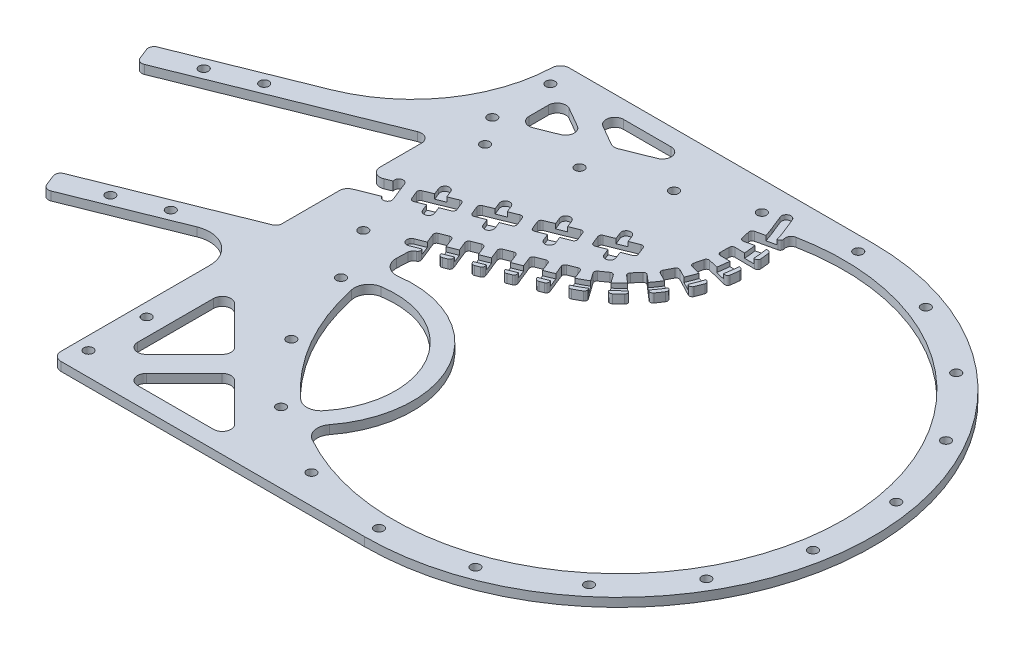
from build123d import *

# Parameters (mm, degrees)
SKETCH_1_R                       = 77.5
EXTRUDE_1_DEPTH                  = 3
SKETCH_3_R                       = 1.6
CUT_EXTRUDE_1_DEPTH              = 3
PATTERN_CIRCULAR_1_OUTLINE_R     = 1.6
PATTERN_CIRCULAR_1_DEPTH         = 3
SKETCH_4_R                       = 1.6
CUT_EXTRUDE_2_DEPTH              = 3
PATTERN_LINEAR_1_COUNT           = 3
PATTERN_LINEAR_1_PITCH           = 25
EXTRUDE_4_DEPTH                  = 3
CUT_EXTRUDE_3_DEPTH              = 1.6
CUT_EXTRUDE_4_DEPTH              = 11.6
FILLET_1_R                       = 1
PATTERN_CIRCULAR_2_COUNT         = 7
PATTERN_CIRCULAR_2_ANGLE         = 81
FILLET_1_OF_PATTERN_CIRCULAR_2_R = 1
FILLET_2_R                       = 2
PATTERN_LINEAR_2_COUNT           = 5
PATTERN_LINEAR_2_PITCH           = 8.5
FILLET_1_OF_PATTERN_LINEAR_2_R   = 1
FILLET_3_R                       = 2
FILLET_4_R                       = 1
CUT_EXTRUDE_5_DEPTH              = 11.6
FILLET_5_R                       = 1
CUT_EXTRUDE_6_DEPTH              = 1.6
PATTERN_LINEAR_3_COUNT           = 4
PATTERN_LINEAR_3_PITCH           = 16
FILLET_5_OF_PATTERN_LINEAR_3_R   = 1
CUT_EXTRUDE_7_DEPTH              = 10
SKETCH_16_R                      = 1.5
CUT_EXTRUDE_8_DEPTH              = 10
SKETCH_17_R                      = 1.6
EXTRUDE_6_DEPTH                  = 3
FILLET_6_R                       = 2
FILLET_7_R                       = 3
FILLET_8_R                       = 3
FILLET_9_R                       = 10
FILLET_10_R                      = 50
FILLET_11_R                      = 2
SKETCH_19_R                      = 1.6
CUT_EXTRUDE_10_DEPTH             = 10
SKETCH_22_R                      = 1.6
CUT_EXTRUDE_11_DEPTH             = 11.6
CUT_EXTRUDE_12_DEPTH             = 11.6
FILLET_12_R                      = 3
FILLET_13_R                      = 3
EXTRUDE_START                    = -3
EXTRUDE_7_DEPTH                  = 3
FILLET_14_R                      = 5


# Read off the part's stored shape, not the designer's step: 阵列(圆周)1
with BuildPart() as part:
    # 草图1 → 凸台-拉伸1 (new body)
    with BuildSketch(Plane(origin=(0, 0, 0), x_dir=(1, 0, 0), z_dir=(0, 1, 0))):
        with BuildLine():
            Line((-107.5, 87.5), (0, 87.5))
            ThreePointArc((0, 87.5), (87.5, 0), (0, -87.5))
            Line((0, -87.5), (-107.5, -87.5))
            Line((-107.5, -87.5), (-107.5, 87.5))
        make_face()
        with Locations(Location((0, 0, 0), (0, 0, 270))):
            Circle(SKETCH_1_R, mode=Mode.SUBTRACT)
    extrude(amount=EXTRUDE_1_DEPTH)

    # 草图3 → 切除-拉伸1 (cut)
    with BuildSketch(Plane(origin=(0, 3, 0), x_dir=(1, 0, 0), z_dir=(0, 1, 0))):
        with Locations(Location((0, 82.5, 0), (0, 0, 270))):
            Circle(SKETCH_3_R)
    extrude(amount=-CUT_EXTRUDE_1_DEPTH, mode=Mode.SUBTRACT)

    # 阵列(圆周)1 outline → 阵列(圆周)1 (cut)
    with BuildSketch(Plane(origin=(0, 0, 0), x_dir=(1, 0, 0), z_dir=(0, 1, 0))):
        with Locations((28.216661824, 77.524641215)):
            Circle(PATTERN_CIRCULAR_1_OUTLINE_R)
        with Locations((53.029977799, 63.198666557)):
            Circle(PATTERN_CIRCULAR_1_OUTLINE_R)
        with Locations((71.447095812, 41.25)):
            Circle(PATTERN_CIRCULAR_1_OUTLINE_R)
        with Locations((81.246639624, 14.325974658)):
            Circle(PATTERN_CIRCULAR_1_OUTLINE_R)
        with Locations((81.246639624, -14.325974658)):
            Circle(PATTERN_CIRCULAR_1_OUTLINE_R)
        with Locations((71.447095812, -41.25)):
            Circle(PATTERN_CIRCULAR_1_OUTLINE_R)
        with Locations((53.029977799, -63.198666557)):
            Circle(PATTERN_CIRCULAR_1_OUTLINE_R)
        with Locations((28.216661824, -77.524641215)):
            Circle(PATTERN_CIRCULAR_1_OUTLINE_R)
        with Locations((0, -82.5)):
            Circle(PATTERN_CIRCULAR_1_OUTLINE_R)
        with Locations((-28.216661824, -77.524641215)):
            Circle(PATTERN_CIRCULAR_1_OUTLINE_R)
        with Locations((-53.029977799, -63.198666557)):
            Circle(PATTERN_CIRCULAR_1_OUTLINE_R)
        with Locations((-71.447095812, -41.25)):
            Circle(PATTERN_CIRCULAR_1_OUTLINE_R)
        with Locations((-81.246639624, -14.325974658)):
            Circle(PATTERN_CIRCULAR_1_OUTLINE_R)
        with Locations((-28.216661824, 77.524641215)):
            Circle(PATTERN_CIRCULAR_1_OUTLINE_R)
    extrude(amount=PATTERN_CIRCULAR_1_DEPTH, mode=Mode.SUBTRACT)

    # 草图4 → 切除-拉伸2 (cut)
    with BuildSketch(Plane(origin=(0, 3, 0), x_dir=(1, 0, 0), z_dir=(0, 1, 0))):
        with Locations(Location((-49.817794007, 68.881691329, 0), (0, 0, 270))):
            Circle(SKETCH_4_R)
    cut_extrude_2 = extrude(amount=-CUT_EXTRUDE_2_DEPTH, mode=Mode.SUBTRACT)

    # 阵列(线性)1: 切除-拉伸2 ×3
    with Locations(*[Vector(-0.9276972686292775, 0, 0.37333333333333385) * (i * PATTERN_LINEAR_1_PITCH) for i in range(1, PATTERN_LINEAR_1_COUNT)]):
        add(cut_extrude_2, mode=Mode.SUBTRACT)

    # 草图6 → 凸台-拉伸4 (add)
    with BuildSketch(Plane(origin=(0, 3, 0), x_dir=(1, 0, 0), z_dir=(0, 1, 0))):
        with BuildLine():
            Line((-97.5, 44.303245671), (-17.609017449, 76.453784243))
            ThreePointArc((-17.609017449, 76.453784243), (-17.941394869, 43.544687501), (-41.446666667, 20.509468359))
            Line((-41.446666667, 20.509468359), (-97.5, -2.048081917))
            Line((-97.5, -2.048081917), (-97.5, 44.303245671))
        make_face()
    extrude(amount=-EXTRUDE_4_DEPTH)

    # 草图7 → 切除-拉伸3 (cut)
    with BuildSketch(Plane(origin=(0, 3, 0), x_dir=(1, 0, 0), z_dir=(0, 1, 0))):
        with BuildLine():
            Line((-43.164, 24.776875795), (-80.271890745, 9.843542461))
            ThreePointArc((-80.271890745, 9.843542461), (-81.158873042, 7.761893498), (-79.077224079, 6.874911202))
            Line((-79.077224079, 6.874911202), (-41.969333333, 21.808244535))
            ThreePointArc((-41.969333333, 21.808244535), (-19.229349455, 44.093479798), (-18.907793625, 75.931117577))
            Line((-18.907793625, 75.931117577), (-20.774460292, 80.56960392))
            ThreePointArc((-20.774460292, 80.56960392), (-22.856109255, 81.456586216), (-23.743091551, 79.374937253))
            Line((-23.743091551, 79.374937253), (-21.876424885, 74.73645091))
            ThreePointArc((-21.876424885, 74.73645091), (-22.173245651, 45.347862191), (-43.164, 24.776875795))
        make_face()
    extrude(amount=-CUT_EXTRUDE_3_DEPTH, mode=Mode.SUBTRACT)

    # 草图8 → 切除-拉伸4 (cut)
    with BuildSketch(Plane(origin=(0, 3, 0), x_dir=(1, 0, 0), z_dir=(0, 1, 0))):
        Polygon((-42.645909838, 16.79304322), (-47.125909838, 27.925410443), (-42.487423495, 29.79207711), (-38.007423495, 18.659709887), align=None)
    cut_extrude_4 = extrude(amount=-CUT_EXTRUDE_4_DEPTH, mode=Mode.SUBTRACT)

    # 圆角1
    fillet_1_edges = [part.edges().sort_by_distance(p)[0] for p in [
        (-47.125909838, 1.5, -27.925410443),
        (-42.487423495, 1.5, -29.79207711),
    ]]
    fillet(fillet_1_edges, radius=FILLET_1_R)

    # 阵列(圆周)2: 切除-拉伸4 ×7 about axis
    pattern_circular_2_axis = Axis((-57.5, 0, -60.40045091), (0, 1, 0))
    for i in range(1, PATTERN_CIRCULAR_2_COUNT):
        add(cut_extrude_4.rotate(pattern_circular_2_axis, i * PATTERN_CIRCULAR_2_ANGLE / (PATTERN_CIRCULAR_2_COUNT - 1)), mode=Mode.SUBTRACT)

    # 圆角1 of 阵列(圆周)2
    fillet_1_of_pattern_circular_2_edges = [part.edges().sort_by_distance(p)[0] for p in [
        (-39.831399137, 1.5, -31.244481649),
        (-35.75683922, 1.5, -34.142405299),
        (-33.513258133, 1.5, -36.174716358),
        (-30.227785472, 1.5, -39.943757269),
        (-28.520628303, 1.5, -42.443669015),
        (-26.20579864, 1.5, -46.875549387),
        (-25.129403166, 1.5, -49.704916298),
        (-23.913134357, 1.5, -54.554729716),
        (-23.526982365, 1.5, -57.557200527),
        (-23.476485617, 1.5, -62.556945528),
        (-23.801915926, 1.5, -65.566603225),
        (-24.919981699, 1.5, -70.439993105),
    ]]
    fillet(fillet_1_of_pattern_circular_2_edges, radius=FILLET_1_OF_PATTERN_CIRCULAR_2_R)

    # 圆角2
    fillet_2_edges = [part.edges().sort_by_distance(p)[0] for p in [
        (-17.258566556, 1.5, -75.553900498),
    ]]
    fillet(fillet_2_edges, radius=FILLET_2_R)

    # 阵列(线性)2: 切除-拉伸4 ×5
    with Locations(*[Vector(-0.9276972686292775, 0, 0.3733333333333338) * (i * PATTERN_LINEAR_2_PITCH) for i in range(1, PATTERN_LINEAR_2_COUNT)]):
        add(cut_extrude_4, mode=Mode.SUBTRACT)

    # 圆角1 of 阵列(线性)2
    fillet_1_of_pattern_linear_2_edges = [part.edges().sort_by_distance(p)[0] for p in [
        (-55.011336622, 1.5, -24.75207711),
        (-50.372850278, 1.5, -26.618743777),
        (-62.896763405, 1.5, -21.578743777),
        (-58.258277062, 1.5, -23.445410443),
        (-70.782190188, 1.5, -18.405410443),
        (-66.143703845, 1.5, -20.27207711),
        (-78.667616972, 1.5, -15.23207711),
        (-74.029130628, 1.5, -17.098743777),
    ]]
    fillet(fillet_1_of_pattern_linear_2_edges, radius=FILLET_1_OF_PATTERN_LINEAR_2_R)

    # 圆角3
    fillet_3_edges = [part.edges().sort_by_distance(p)[0] for p in [
        (-77.259784267, 1.5, -6.097190752),
    ]]
    fillet(fillet_3_edges, radius=FILLET_3_R)

    # 圆角4
    fillet_4_edges = [part.edges().sort_by_distance(p)[0] for p in [
        (-62.783703845, 1.5, -11.922801692),
        (-59.536763405, 1.5, -13.229468359),
        (-54.898277062, 1.5, -15.096135026),
        (-51.651336622, 1.5, -16.402801692),
        (-47.012850278, 1.5, -18.269468359),
        (-43.765909838, 1.5, -19.576135026),
        (-39.154578245, 1.5, -21.510278622),
        (-34.657293205, 1.5, -23.969547184),
        (-30.582733288, 1.5, -26.867470835),
        (-26.783813436, 1.5, -30.308659954),
        (-23.498340775, 1.5, -34.077700865),
        (-20.607715027, 1.5, -38.310649882),
        (-18.292885364, 1.5, -42.742530254),
        (-16.470290159, 1.5, -47.533325732),
        (-15.25402135, 1.5, -52.383139149),
        (-14.600173589, 1.5, -57.467040967),
        (-14.549676841, 1.5, -62.466785969),
        (-15.100708256, 1.5, -67.562856903),
        (-16.218774029, 1.5, -72.436246784),
        (-67.422190188, 1.5, -10.056135026),
        (-70.669130628, 1.5, -8.749468359),
        (-75.307616972, 1.5, -6.882801692),
    ]]
    fillet(fillet_4_edges, radius=FILLET_4_R)

    # 草图10 → 切除-拉伸5 (cut)
    with BuildSketch(Plane(origin=(0, 3, 0), x_dir=(1, 0, 0), z_dir=(0, 1, 0))):
        Polygon((-38.538550835, 47.550290215), (-49.670918059, 43.070290215), (-47.804251392, 38.431803872), (-36.671884169, 42.911803872), align=None)
    cut_extrude_5 = extrude(amount=-CUT_EXTRUDE_5_DEPTH, mode=Mode.SUBTRACT)

    # 圆角5
    fillet_5_edges = [part.edges().sort_by_distance(p)[0] for p in [
        (-47.804251392, 1.5, -38.431803872),
        (-49.670918059, 1.5, -43.070290215),
        (-38.538550835, 1.5, -47.550290215),
        (-36.671884169, 1.5, -42.911803872),
    ]]
    fillet(fillet_5_edges, radius=FILLET_5_R)

    # 草图11 → 切除-拉伸6 (cut)
    with BuildSketch(Plane(origin=(0, 3, 0), x_dir=(1, 0, 0), z_dir=(0, 1, 0))):
        with BuildLine():
            Line((-42.789050077, 37.755227367), (-46.52238341, 47.032200053))
            ThreePointArc((-46.52238341, 47.032200053), (-45.635401114, 49.113849016), (-43.553752151, 48.22686672))
            Line((-43.553752151, 48.22686672), (-39.820418817, 38.949894033))
            ThreePointArc((-39.820418817, 38.949894033), (-40.707401114, 36.86824507), (-42.789050077, 37.755227367))
        make_face()
    cut_extrude_6 = extrude(amount=-CUT_EXTRUDE_6_DEPTH, mode=Mode.SUBTRACT)

    # 阵列(线性)3: 切除-拉伸5, 切除-拉伸6 ×4
    with Locations(*[Vector(-0.9276972686292776, 0, 0.37333333333333374) * (i * PATTERN_LINEAR_3_PITCH) for i in range(1, PATTERN_LINEAR_3_COUNT)]):
        add(cut_extrude_5, mode=Mode.SUBTRACT)
        add(cut_extrude_6, mode=Mode.SUBTRACT)

    # 圆角5 of 阵列(线性)3
    fillet_5_of_pattern_linear_3_edges = [part.edges().sort_by_distance(p)[0] for p in [
        (-62.64740769, 1.5, -32.458470538),
        (-64.514074357, 1.5, -37.096956881),
        (-53.381707133, 1.5, -41.576956881),
        (-51.515040467, 1.5, -36.938470538),
        (-77.490563988, 1.5, -26.485137205),
        (-79.357230655, 1.5, -31.123623548),
        (-68.224863431, 1.5, -35.603623548),
        (-66.358196765, 1.5, -30.965137205),
        (-92.333720286, 1.5, -20.511803872),
        (-94.200386953, 1.5, -25.150290215),
        (-83.06801973, 1.5, -29.630290215),
        (-81.201353063, 1.5, -24.991803872),
    ]]
    fillet(fillet_5_of_pattern_linear_3_edges, radius=FILLET_5_OF_PATTERN_LINEAR_3_R)

    # 草图15 → 切除-拉伸7 (cut)
    with BuildSketch(Plane(origin=(0, 3, 0), x_dir=(1, 0, 0), z_dir=(0, 1, 0))):
        Polygon((-128.283993423, 4.966392893), (-130.897326757, 11.460273774), (-98.284509361, 24.58465415), (-95.671176028, 18.09077327), align=None)
    extrude(amount=-CUT_EXTRUDE_7_DEPTH, mode=Mode.SUBTRACT)

    # 草图16 → 切除-拉伸8 (cut)
    with BuildSketch(Plane(origin=(0, 3, 0), x_dir=(1, 0, 0), z_dir=(0, 1, 0))):
        with Locations((-99.676055264, 24.02465415)):
            Circle(SKETCH_16_R)
        with Locations((-97.062721931, 17.53077327)):
            Circle(SKETCH_16_R)
    extrude(amount=-CUT_EXTRUDE_8_DEPTH, mode=Mode.SUBTRACT)

    # 草图17 → 凸台-拉伸6 (add)
    # profile 1 of 2: a face of its own
    with BuildSketch(Plane(origin=(0, 3, 0), x_dir=(1, 0, 0), z_dir=(0, 1, 0))):
        Polygon((-107.5, 44.051726839), (-180.536319686, 14.65971114), (-183.522986353, 22.081289289), (-107.5, 52.675229646), align=None)
        with Locations(Location((-167.186496721, 24.343833548, 0), (0, 0, 270))):
            Circle(SKETCH_17_R, mode=Mode.SUBTRACT)
        with Locations(Location((-152.343340423, 30.317166882, 0), (0, 0, 270))):
            Circle(SKETCH_17_R, mode=Mode.SUBTRACT)
    # profile 2 of 2: a face of its own
    with BuildSketch(Plane(origin=(0, 3, 0), x_dir=(1, 0, 0), z_dir=(0, 1, 0))):
        Polygon((-107.5, -18.468668511), (-107.5, -9.845165705), (-161.869653019, -31.725152291), (-158.882986353, -39.14673044), align=None)
        with Locations(Location((-130.69000709, -23.489274699, 0), (0, 0, 90))):
            Circle(SKETCH_17_R, mode=Mode.SUBTRACT)
        with Locations(Location((-145.533163388, -29.462608032, 0), (0, 0, 90))):
            Circle(SKETCH_17_R, mode=Mode.SUBTRACT)
    extrude(amount=-EXTRUDE_6_DEPTH)

    # 圆角6
    fillet_6_edges = [part.edges().sort_by_distance(p)[0] for p in [
        (-107.5, 1.5, 9.845165705),
    ]]
    fillet(fillet_6_edges, radius=FILLET_6_R)

    # 圆角7
    fillet_7_edges = [part.edges().sort_by_distance(p)[0] for p in [
        (-107.5, 1.5, -44.051726839),
    ]]
    fillet(fillet_7_edges, radius=FILLET_7_R)

    # 圆角8
    fillet_8_edges = [part.edges().sort_by_distance(p)[0] for p in [
        (-107.5, 1.5, -13.330498089),
        (-107.5, 1.5, -20.876063045),
    ]]
    fillet(fillet_8_edges, radius=FILLET_8_R)

    # 圆角9
    fillet_9_edges = [part.edges().sort_by_distance(p)[0] for p in [
        (-107.5, 1.5, 18.468668511),
    ]]
    fillet(fillet_9_edges, radius=FILLET_9_R)

    # 圆角10
    fillet_10_edges = [part.edges().sort_by_distance(p)[0] for p in [
        (-107.5, 1.5, -52.675229646),
    ]]
    fillet(fillet_10_edges, radius=FILLET_10_R)

    # 圆角11
    fillet_11_edges = [part.edges().sort_by_distance(p)[0] for p in [
        (-180.536319686, 1.5, -14.65971114),
        (-183.522986353, 1.5, -22.081289289),
        (-158.882986353, 1.5, 39.14673044),
        (-161.869653019, 1.5, 31.725152291),
    ]]
    fillet(fillet_11_edges, radius=FILLET_11_R)

    # 草图19 → 切除-拉伸10 (cut)
    with BuildSketch(Plane(origin=(0, 3, 0), x_dir=(1, 0, 0), z_dir=(0, 1, 0))):
        with Locations(Location((-91.5, 3.6, 0), (0, 0, 270))):
            Circle(SKETCH_19_R)
    extrude(amount=-CUT_EXTRUDE_10_DEPTH, mode=Mode.SUBTRACT)

    # 草图22 → 切除-拉伸11 (cut)
    with BuildSketch(Plane(origin=(0, 3, 0), x_dir=(1, 0, 0), z_dir=(0, 1, 0))):
        with Locations(Location((-103, 79.5, 0), (0, 0, 270))):
            Circle(SKETCH_22_R)
        with Locations(Location((-103, 59.5, 0), (0, 0, 270))):
            Circle(SKETCH_22_R)
        with Locations(Location((-103, -59.5, 0), (0, 0, 90))):
            Circle(SKETCH_22_R)
        with Locations(Location((-103, -79.5, 0), (0, 0, 90))):
            Circle(SKETCH_22_R)
    extrude(amount=-CUT_EXTRUDE_11_DEPTH, mode=Mode.SUBTRACT)

    # 草图23 → 切除-拉伸12 (cut)
    with BuildSketch(Plane(origin=(0, 3, 0), x_dir=(1, 0, 0), z_dir=(0, 1, 0))):
        Polygon((-91, 81.5), (-47.926801625, 81.5), (-73.30832862, 71.285708767), align=None)
        Polygon((-97, 61.75146635), (-97, 78.035898385), (-80.379508274, 68.440053013), align=None)
        Polygon((-97, -35.228968082), (-97, -75.843145751), (-76.692911166, -55.536056916), align=None)
        Polygon((-91.343145751, -81.5), (-50.728968082, -81.5), (-71.036056916, -61.192911166), align=None)
    extrude(amount=-CUT_EXTRUDE_12_DEPTH, mode=Mode.SUBTRACT)

    # 圆角12
    fillet_12_edges = [part.edges().sort_by_distance(p)[0] for p in [
        (-80.379508274, 1.5, -68.440053013),
        (-97, 1.5, -61.75146635),
        (-97, 1.5, -78.035898385),
        (-71.036056916, 1.5, 61.192911166),
        (-50.728968082, 1.5, 81.5),
        (-91.343145751, 1.5, 81.5),
        (-97, 1.5, 35.228968082),
        (-76.692911166, 1.5, 55.536056916),
        (-97, 1.5, 75.843145751),
        (-47.926801625, 1.5, -81.5),
        (-73.30832862, 1.5, -71.285708767),
        (-91, 1.5, -81.5),
    ]]
    fillet(fillet_12_edges, radius=FILLET_12_R)

    # 圆角13
    fillet_13_edges = [part.edges().sort_by_distance(p)[0] for p in [
        (-107.5, 1.5, -87.5),
        (-107.5, 1.5, 87.5),
    ]]
    fillet(fillet_13_edges, radius=FILLET_13_R)

    # 草图24 → 凸台-拉伸7 (add)
    with BuildSketch(Plane(origin=(0, 3, 0), x_dir=(1, 0, 0), z_dir=(0, 1, 0)).offset(EXTRUDE_START)):
        with BuildLine():
            ThreePointArc((-43.224561232, -64.326412198), (-36.806079661, -21.25), (-77.320587714, -5.270361995))
            ThreePointArc((-77.320587714, -5.270361995), (-77.051610613, -8.324620233), (-76.662034132, -11.365848969))
            ThreePointArc((-76.662034132, -11.365848969), (-42.002232084, -24.25), (-48.174131009, -60.708344579))
            ThreePointArc((-48.174131009, -60.708344579), (-45.735137905, -62.566342077), (-43.224561232, -64.326412198))
        make_face()
    extrude(amount=EXTRUDE_7_DEPTH)

    # 圆角14
    fillet_14_edges = [part.edges().sort_by_distance(p)[0] for p in [
        (-48.174131009, 1.5, 60.708344579),
        (-43.224561232, 1.5, 64.326412198),
        (-77.320587714, 1.5, 5.270361995),
        (-76.662034132, 1.5, 11.365848969),
    ]]
    fillet(fillet_14_edges, radius=FILLET_14_R)


solid = part.part
